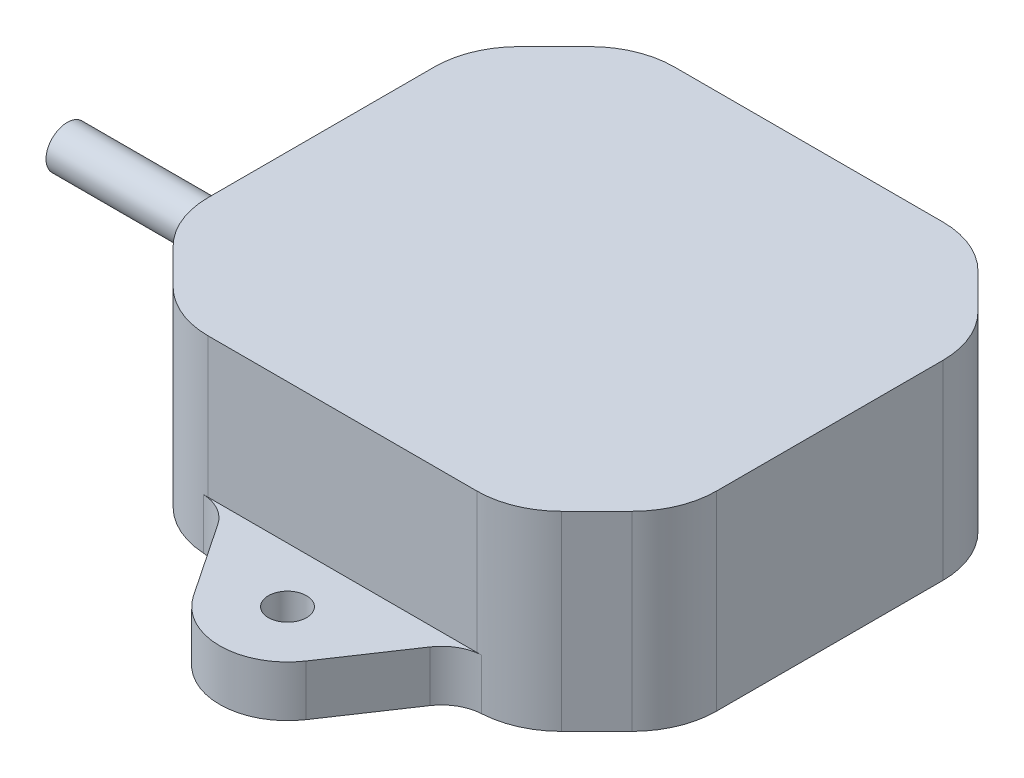
from build123d import *

# Parameters (mm, degrees)
SKETCH1_W           = 60
SKETCH1_H           = 55
BOSS_EXTRUDE1_DEPTH = 11.25
SKETCH2_R           = 2.25
BOSS_EXTRUDE2_DEPTH = 6
CHAMFER1_SIZE       = 10
FILLET1_R           = 10
FILLET2_R           = 5
SKETCH3_R           = 2.5
BOSS_EXTRUDE3_DEPTH = 30


with BuildPart() as part:
    # Sketch1 → Boss-Extrude1 (new, symmetric)
    with BuildSketch(Plane(origin=(0, 0, 0), x_dir=(1, 0, 0), z_dir=(0, 1, 0))):
        Rectangle(SKETCH1_W, SKETCH1_H)
    extrude(amount=BOSS_EXTRUDE1_DEPTH, both=True)

    # Sketch2 → Boss-Extrude2 (add)
    with BuildSketch(Plane.XZ.offset(11.25)):
        with BuildLine():
            Line((-14, -27.5), (-6.641845526, -38.459359596))
            ThreePointArc((-6.641845526, -38.459359596), (0, -42), (6.641845526, -38.459359596))
            Line((6.641845526, -38.459359596), (14, -27.5))
            Line((14, -27.5), (-14, -27.5))
        make_face()
        with Locations(Location((0, -34, 0), (0, 0, 270))):
            Circle(SKETCH2_R, mode=Mode.SUBTRACT)
    boss_extrude2 = extrude(amount=-BOSS_EXTRUDE2_DEPTH)

    # Mirror1: Boss-Extrude2 across plane
    add(boss_extrude2.mirror(Plane.XY))

    # Chamfer1
    chamfer1_edges = [part.edges().sort_by_distance(p)[0] for p in [
        (-30, 0, -27.5),
        (30, 0, -27.5),
        (30, 0, 27.5),
        (-30, 0, 27.5),
    ]]
    chamfer(chamfer1_edges, length=CHAMFER1_SIZE)

    # Fillet1
    fillet1_edges = [part.edges().sort_by_distance(p)[0] for p in [
        (20, 0, 27.5),
        (-20, 0, 27.5),
        (-30, 0, -17.5),
        (-30, 0, 17.5),
        (30, 0, -17.5),
        (30, 0, 17.5),
        (-20, 0, -27.5),
        (20, 0, -27.5),
    ]]
    fillet(fillet1_edges, radius=FILLET1_R)

    # Fillet2
    # the kernel refuses this fillet: 5 mm, written as the material it adds along each edge
    with BuildSketch(Plane(origin=(14, -11.25, -27.5), x_dir=(0.9999804368407044, 0, 0.006255072811241643), z_dir=(0, 1, 0)), Plane(origin=(-14, -11.25, 27.5), x_dir=(-0.9999804368407044, 0, -0.006255072811243166), z_dir=(0, 1, 0))) as fillet2_piece_1:
        with BuildLine():
            CenterArc((2.6493765, 4.994091646), FILLET2_R, 214.235948787, 52.978387625)
            Line((-1.484262233, 2.181080656), (-1.897626106, 1.899779557))
            Line((-1.897626106, 1.899779557), (-0.413363873, -0.281301099))
            Line((-0.413363873, -0.281301099), (0.003127536, -0.499990218))
            ThreePointArc((0.003127536, -0.499990218), (1.860955567, -0.488369141), (2.382077328, -0.499409165))
            Line((2.382077328, -0.499409165), (2.406377253, 0))
        make_face()
    extrude(amount=6)
    with BuildSketch(Plane(origin=(-14, -11.25, -27.5), x_dir=(-0.9999804368407044, 0, 0.00625507281124311), z_dir=(0, 1, 0)), Plane(origin=(14, -11.25, 27.5), x_dir=(0.9999804368407044, 0, -0.006255072811241634), z_dir=(0, 1, 0))) as fillet2_piece_2:
        with BuildLine():
            CenterArc((2.6493765, -4.994091646), FILLET2_R, 92.785663588, 52.978387625)
            Line((-1.484262233, -2.181080656), (-1.897626106, -1.899779557))
            Line((-1.897626106, -1.899779557), (-0.413363873, 0.281301099))
            Line((-0.413363873, 0.281301099), (0.003127536, 0.499990218))
            ThreePointArc((0.003127536, 0.499990218), (1.860955567, 0.488369141), (2.382077328, 0.499409165))
            Line((2.382077328, 0.499409165), (2.406377253, 0))
        make_face()
    extrude(amount=6)

    # Sketch3 → Boss-Extrude3 (add)
    with BuildSketch(Plane.ZY.offset(30)):
        with Locations(Location((0, -5.25, 0), (0, 0, 180))):
            Circle(SKETCH3_R)
    extrude(amount=BOSS_EXTRUDE3_DEPTH)


solid = part.part
